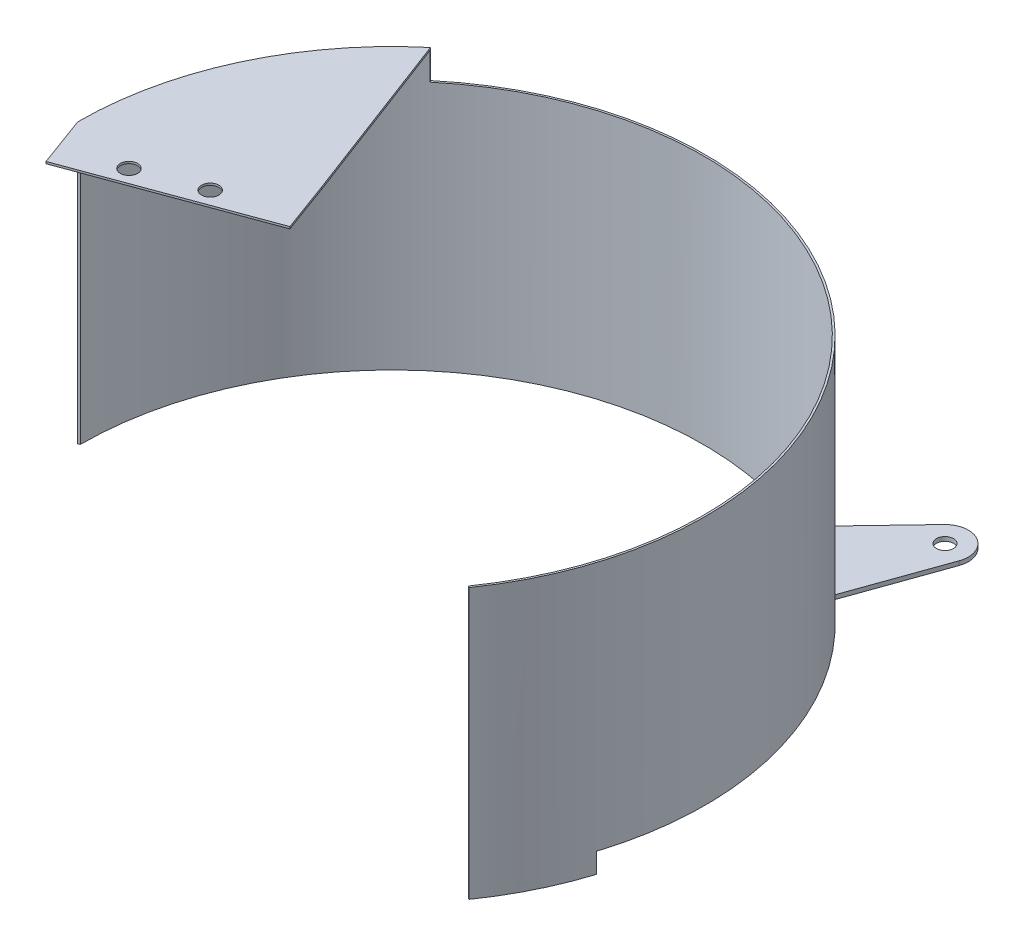
from build123d import *
from build123d.topology import SkipClean

# Parameters (mm, degrees)
BASE_FLANGE1_DEPTH   = 102.87
CUT_EXTRUDE1_START   = -7.62
CUT_EXTRUDE1_DEPTH   = 7.62
BOSS_EXTRUDE5_START  = -95.25
BOSS_EXTRUDE5_DEPTH  = 95.25
BOSS_EXTRUDE6_DEPTH  = 10.16
BOSS_EXTRUDE7_DEPTH  = 0.762
SKETCH12_W           = 72.378245623
SKETCH12_H           = 0.762
BOSS_EXTRUDE8_DEPTH  = 20.33854962
SKETCH13_R           = 3.3
CUT_EXTRUDE2_DEPTH   = 204.597121983
SKETCH15_R           = 3.2639
BOSS_EXTRUDE10_DEPTH = 1.5875


# Read off the part's stored shape, not the designer's step: Cut-Extrude1
# Sheet-metal steps are written as plain solids
with BuildPart() as part:
    # Sketch2 → Base-Flange1 (new body)
    with BuildSketch(Plane(origin=(0, 0, 0), x_dir=(1, 0, 0), z_dir=(0, 1, 0))):
        with BuildLine():
            ThreePointArc((-119.38, 0), (35.898258345, 113.85472958), (97.790371047, -68.473554972))
            Line((97.790371047, -68.473554972), (97.186983651, -68.051058569))
            ThreePointArc((97.186983651, -68.051058569), (35.676758453, 113.152221674), (-118.6434, 0))
            Line((-118.6434, 0), (-119.38, 0))
        make_face()
    extrude(amount=BASE_FLANGE1_DEPTH)

    # Cut-Extrude1 outline → Cut-Extrude1 (cut)
    with BuildSketch(Plane.XZ.offset(CUT_EXTRUDE1_START)):
        with BuildLine():
            ThreePointArc((-119.38, 0), (18.160489843, -117.990597119), (113.85472958, 35.898258345))
            Line((113.85472958, 35.898258345), (113.152221674, 35.676758453))
            ThreePointArc((113.152221674, 35.676758453), (18.048435757, -117.262570031), (-118.6434, 0))
            Line((-118.6434, 0), (-119.38, 0))
        make_face()
    extrude(amount=CUT_EXTRUDE1_DEPTH, mode=Mode.SUBTRACT)

    # Sketch9 → Boss-Extrude5 (add)
    with BuildSketch(Plane(origin=(0, 102.87, 0), x_dir=(1, 0, 0), z_dir=(0, 1, 0)).offset(BOSS_EXTRUDE5_START)):
        with BuildLine():
            Line((-119.379693576, -0.270484204), (-118.6434, 0))
            Line((-118.6434, 0), (-119.38, 0))
            ThreePointArc((-119.38, 0), (-119.379923394, -0.135242189), (-119.379693576, -0.270484204))
        make_face()
    extrude(amount=BOSS_EXTRUDE5_DEPTH)

    # Sketch10 → Boss-Extrude6 (add)
    with SkipClean():  # the faces are left unmerged after this step: merging them gives an invalid solid
        with BuildSketch(Plane(origin=(0, 102.87, 0), x_dir=(1, 0, 0), z_dir=(0, 1, 0))):
            with BuildLine():
                Line((-119.379693576, -0.270484204), (-118.6434, 0))
                ThreePointArc((-118.6434, 0), (-107.527437301, 50.140867475), (-76.262507491, 90.886117283))
                Line((-76.262507491, 90.886117283), (-76.735984844, 91.45038562))
                ThreePointArc((-76.735984844, 91.45038562), (-108.252110006, 50.329564663), (-119.379693576, -0.270484204))
            make_face()
        extrude(amount=BOSS_EXTRUDE6_DEPTH)

    # Sketch11 → Boss-Extrude7 (add)
    with SkipClean():  # the faces are left unmerged after this step: merging them gives an invalid solid
        with BuildSketch(Plane(origin=(0, 113.03, 0), x_dir=(1, 0, 0), z_dir=(0, 1, 0))):
            with BuildLine():
                Line((-119.379693576, -0.270484204), (-51.440692331, 24.687531528))
                Line((-51.440692331, 24.687531528), (-76.735984844, 91.45038562))
                ThreePointArc((-76.735984844, 91.45038562), (-108.252110006, 50.329564663), (-119.379693576, -0.270484204))
            make_face()
        extrude(amount=BOSS_EXTRUDE7_DEPTH)

    # Sketch12 → Boss-Extrude8 (add)
    with SkipClean():  # the faces are left unmerged after this step: merging them gives an invalid solid
        with BuildSketch(Plane(origin=(-14.107419738, 0, -38.402251904), x_dir=(0.9386660406079884, 0, -0.3448275862069655), z_dir=(0.3448275862069655, 0, 0.9386660406079884))):
            with Locations((-75.961811901, 113.411)):
                Rectangle(SKETCH12_W, SKETCH12_H)
        extrude(amount=BOSS_EXTRUDE8_DEPTH)

    # Sketch13 → Cut-Extrude2 (cut, through all)
    with SkipClean():  # the faces are left unmerged after this step: merging them gives an invalid solid
        with BuildSketch(Plane(origin=(0, 113.792, 0), x_dir=(1, 0, 0), z_dir=(0, 1, 0))):
            with Locations(Location((-94.258662261, -5.860928581, 0), (0, 0, 270))):
                Circle(SKETCH13_R)
            with Locations(Location((-71.633967235, 2.450493285, 0), (0, 0, 270))):
                Circle(SKETCH13_R)
        extrude(amount=-CUT_EXTRUDE2_DEPTH, mode=Mode.SUBTRACT)

    # Sketch15 → Boss-Extrude10 (add)
    with SkipClean():  # the faces are left unmerged after this step: merging them gives an invalid solid
        with BuildSketch(Plane.XZ.offset(-7.62)):
            with BuildLine():
                Line((76.054879624, -92.017605302), (88.669451617, -127.404882133))
                ThreePointArc((88.669451617, -127.404882133), (84.957156503, -137.959730204), (73.860989671, -136.524099874))
                Line((73.860989671, -136.524099874), (47.938477772, -109.332002401))
                ThreePointArc((47.938477772, -109.332002401), (62.598204897, -101.651606695), (76.054879624, -92.017605302))
            make_face()
            with Locations(Location((80.295588053, -130.389929705, 0), (0, 0, 270))):
                Circle(SKETCH15_R, mode=Mode.SUBTRACT)
        extrude(amount=-BOSS_EXTRUDE10_DEPTH)


solid = part.part
